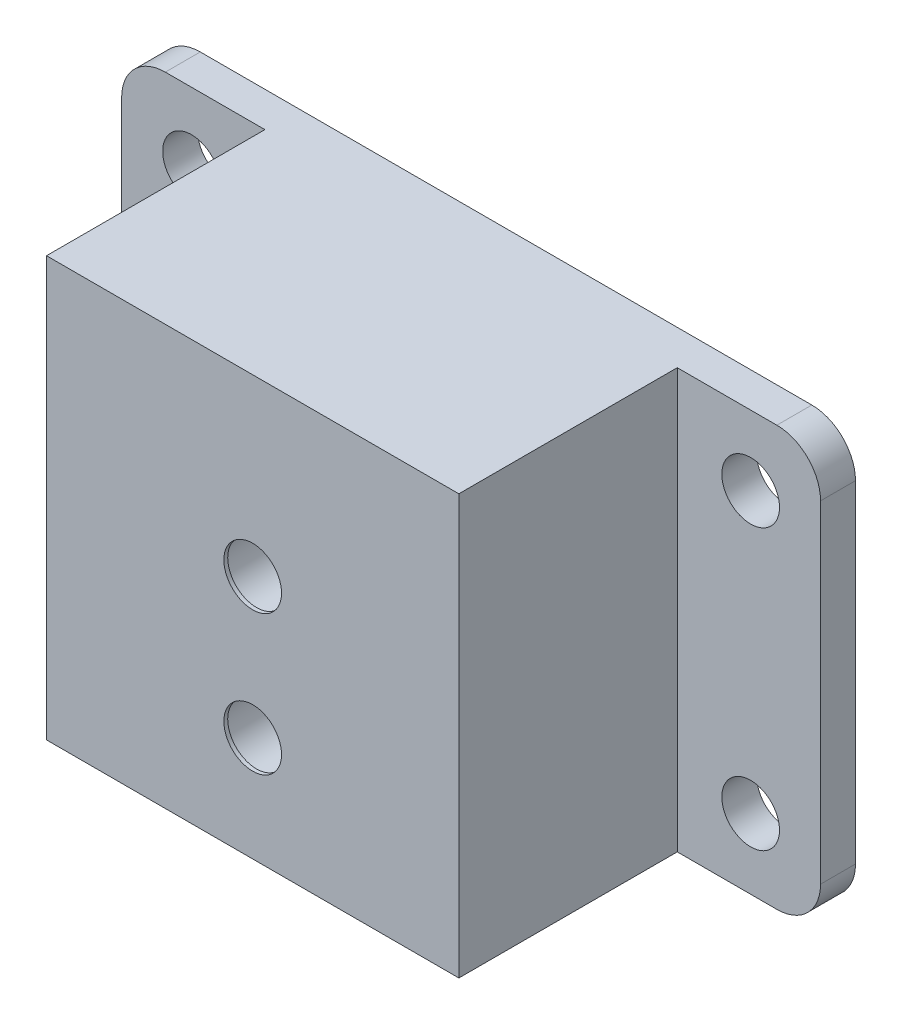
from build123d import *

# Parameters (mm, degrees)
SKETCH1_R           = 1.65
BOSS_EXTRUDE1_DEPTH = 2
BOSS_EXTRUDE2_DEPTH = 7.5
SKETCH3_W           = 23.6
SKETCH3_H           = 24
SKETCH3_R           = 1.65
BOSS_EXTRUDE3_DEPTH = 5
FILLET1_R           = 2.5
SKETCH5_R           = 2
CUT_EXTRUDE1_DEPTH  = 4.78


with BuildPart() as part:
    # Sketch1 → Boss-Extrude1 (new body)
    with BuildSketch(Plane(origin=(0, 0, 0), x_dir=(0, 1, 0), z_dir=(0, 0, 1))):
        Polygon((-24, 12.2), (-4, 12.2), (-4, 27.8), (-24, 27.8), (-24, 40), (0, 40), (0, 0), (-24, 0), align=None)
        with Locations((-20, 4)):
            Circle(SKETCH1_R, mode=Mode.SUBTRACT)
        with Locations((-4, 4)):
            Circle(SKETCH1_R, mode=Mode.SUBTRACT)
        with Locations((-4, 36)):
            Circle(SKETCH1_R, mode=Mode.SUBTRACT)
        with Locations((-20, 36)):
            Circle(SKETCH1_R, mode=Mode.SUBTRACT)
    extrude(amount=BOSS_EXTRUDE1_DEPTH)

    # Sketch2 → Boss-Extrude2 (add)
    with BuildSketch(Plane.XY.offset(2)):
        Polygon((-27.8, -24), (-27.8, -4), (-12.2, -4), (-12.2, -24), (-8.2, -24), (-8.2, 0), (-31.8, 0), (-31.8, -24), align=None)
    extrude(amount=BOSS_EXTRUDE2_DEPTH)

    # Sketch3 → Boss-Extrude3 (add)
    with BuildSketch(Plane.XY.offset(9.5)):
        with Locations((-20, -12)):
            Rectangle(SKETCH3_W, SKETCH3_H)
        with Locations((-20, -18)):
            Circle(SKETCH3_R, mode=Mode.SUBTRACT)
        with Locations((-20, -10)):
            Circle(SKETCH3_R, mode=Mode.SUBTRACT)
    extrude(amount=BOSS_EXTRUDE3_DEPTH)

    # Fillet1
    fillet1_edges = [part.edges().sort_by_distance(p)[0] for p in [
        (0, -24, 1),
        (0, 0, 1),
        (-40, 0, 1),
        (-40, -24, 1),
    ]]
    fillet(fillet1_edges, radius=FILLET1_R)

    # Sketch5 → Cut-Extrude1 (cut)
    with BuildSketch(Plane(origin=(0, 0, 9.5), x_dir=(1, 0, 0), z_dir=(0, 0, -1))):
        with Locations((-20, 18)):
            Circle(SKETCH5_R)
        with Locations((-20, 10)):
            Circle(SKETCH5_R)
    extrude(amount=-CUT_EXTRUDE1_DEPTH, mode=Mode.SUBTRACT)


solid = part.part
